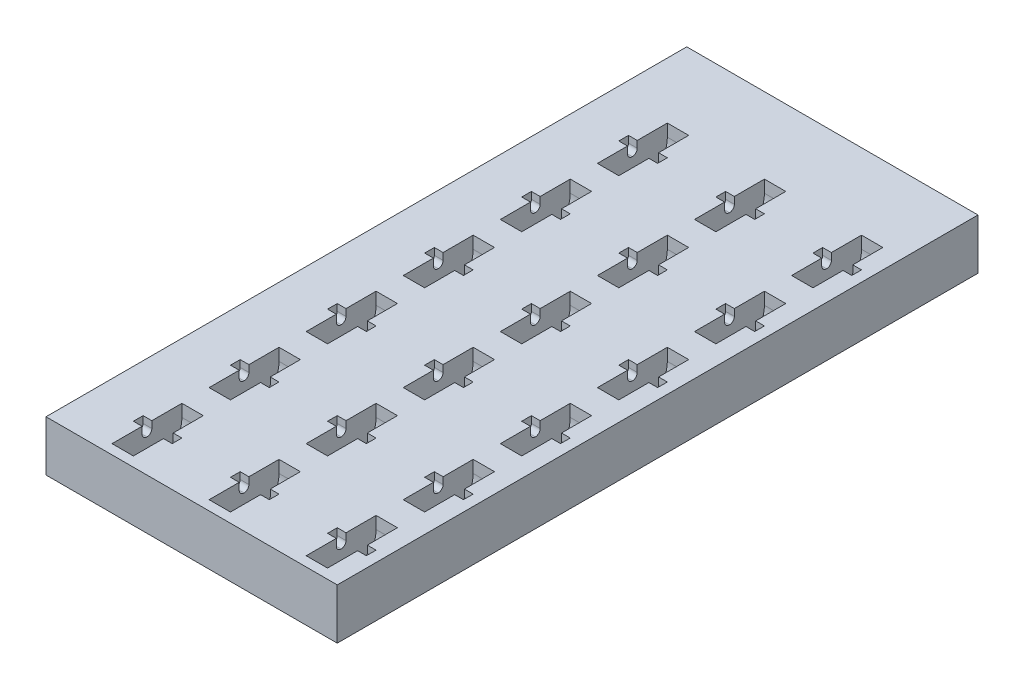
from build123d import *

# Parameters (mm, degrees)
SKETCH1_W              = 150
SKETCH1_H              = 330
BOSS_EXTRUDE1_DEPTH    = 26
SKETCH2_W              = 11
SKETCH2_H              = 36
CUT_EXTRUDE1_DEPTH     = 22
SKETCH3_W              = 20
SKETCH3_H              = 5
CUT_EXTRUDE2_DEPTH     = 6
FILLET1_R              = 15.7
FILLET2_R              = 2.5
LPATTERN1_COUNT        = 3
LPATTERN1_PITCH        = 50
LPATTERN1_COUNT_DIR2   = 6
LPATTERN1_PITCH_DIR2   = 50
FILLET1_OF_LPATTERN1_R = 15.7
FILLET2_OF_LPATTERN1_R = 2.5


with BuildPart() as part:
    # Sketch1 → Boss-Extrude1 (new body)
    with BuildSketch(Plane(origin=(0, 0, 0), x_dir=(1, 0, 0), z_dir=(0, 1, 0))):
        Rectangle(SKETCH1_W, SKETCH1_H)
    extrude(amount=BOSS_EXTRUDE1_DEPTH)

    # Sketch2 → Cut-Extrude1 (cut)
    with BuildSketch(Plane(origin=(0, 26, 0), x_dir=(1, 0, 0), z_dir=(0, 1, 0))):
        with Locations((59.5, -142)):
            Rectangle(SKETCH2_W, SKETCH2_H)
    cut_extrude1 = extrude(amount=-CUT_EXTRUDE1_DEPTH, mode=Mode.SUBTRACT)

    # Sketch3 → Cut-Extrude2 (cut)
    with BuildSketch(Plane(origin=(0, 26, 0), x_dir=(1, 0, 0), z_dir=(0, 1, 0))):
        with Locations((59.5, -142)):
            Rectangle(SKETCH3_W, SKETCH3_H)
    cut_extrude2 = extrude(amount=-CUT_EXTRUDE2_DEPTH, mode=Mode.SUBTRACT)

    # Fillet1
    fillet1_edges = [part.edges().sort_by_distance(p)[0] for p in [
        (59.5, 4, 160),
        (59.5, 4, 124),
    ]]
    fillet(fillet1_edges, radius=FILLET1_R)

    # Fillet2
    fillet2_edges = [part.edges().sort_by_distance(p)[0] for p in [
        (51.75, 20, 144.5),
        (51.75, 20, 139.5),
        (67.25, 20, 144.5),
        (67.25, 20, 139.5),
    ]]
    fillet(fillet2_edges, radius=FILLET2_R - 0.0001)  # a hair under: the kernel refuses the full size

    # LPattern1: Cut-Extrude1, Cut-Extrude2 3 × 6
    with Locations(*[(-i * LPATTERN1_PITCH, 0, -j * LPATTERN1_PITCH_DIR2) for i in range(LPATTERN1_COUNT) for j in range(LPATTERN1_COUNT_DIR2) if (i, j) != (0, 0)]):
        add(cut_extrude1, mode=Mode.SUBTRACT)
        add(cut_extrude2, mode=Mode.SUBTRACT)

    # Fillet1 of LPattern1
    fillet1_of_lpattern1_edges = [part.edges().sort_by_distance(p)[0] for p in [
        (59.5, 4, 110),
        (59.5, 4, 74),
        (59.5, 4, 60),
        (59.5, 4, 24),
        (59.5, 4, 10),
        (59.5, 4, -26),
        (59.5, 4, -40),
        (59.5, 4, -76),
        (59.5, 4, -90),
        (59.5, 4, -126),
        (9.5, 4, 160),
        (9.5, 4, 124),
        (9.5, 4, 110),
        (9.5, 4, 74),
        (9.5, 4, 60),
        (9.5, 4, 24),
        (9.5, 4, 10),
        (9.5, 4, -26),
        (9.5, 4, -40),
        (9.5, 4, -76),
        (9.5, 4, -90),
        (9.5, 4, -126),
        (-40.5, 4, 160),
        (-40.5, 4, 124),
        (-40.5, 4, 110),
        (-40.5, 4, 74),
        (-40.5, 4, 60),
        (-40.5, 4, 24),
        (-40.5, 4, 10),
        (-40.5, 4, -26),
        (-40.5, 4, -40),
        (-40.5, 4, -76),
        (-40.5, 4, -90),
        (-40.5, 4, -126),
    ]]
    fillet(fillet1_of_lpattern1_edges, radius=FILLET1_OF_LPATTERN1_R)

    # Fillet2 of LPattern1
    fillet2_of_lpattern1_edges = [part.edges().sort_by_distance(p)[0] for p in [
        (51.75, 20, 94.5),
        (51.75, 20, 89.5),
        (67.25, 20, 94.5),
        (67.25, 20, 89.5),
        (51.75, 20, 44.5),
        (51.75, 20, 39.5),
        (67.25, 20, 44.5),
        (67.25, 20, 39.5),
        (51.75, 20, -5.5),
        (51.75, 20, -10.5),
        (67.25, 20, -5.5),
        (67.25, 20, -10.5),
        (51.75, 20, -55.5),
        (51.75, 20, -60.5),
        (67.25, 20, -55.5),
        (67.25, 20, -60.5),
        (51.75, 20, -105.5),
        (51.75, 20, -110.5),
        (67.25, 20, -105.5),
        (67.25, 20, -110.5),
        (1.75, 20, 144.5),
        (1.75, 20, 139.5),
        (17.25, 20, 144.5),
        (17.25, 20, 139.5),
        (1.75, 20, 94.5),
        (1.75, 20, 89.5),
        (17.25, 20, 94.5),
        (17.25, 20, 89.5),
        (1.75, 20, 44.5),
        (1.75, 20, 39.5),
        (17.25, 20, 44.5),
        (17.25, 20, 39.5),
        (1.75, 20, -5.5),
        (1.75, 20, -10.5),
        (17.25, 20, -5.5),
        (17.25, 20, -10.5),
        (1.75, 20, -55.5),
        (1.75, 20, -60.5),
        (17.25, 20, -55.5),
        (17.25, 20, -60.5),
        (1.75, 20, -105.5),
        (1.75, 20, -110.5),
        (17.25, 20, -105.5),
        (17.25, 20, -110.5),
        (-48.25, 20, 144.5),
        (-48.25, 20, 139.5),
        (-32.75, 20, 144.5),
        (-32.75, 20, 139.5),
        (-48.25, 20, 94.5),
        (-48.25, 20, 89.5),
        (-32.75, 20, 94.5),
        (-32.75, 20, 89.5),
        (-48.25, 20, 44.5),
        (-48.25, 20, 39.5),
        (-32.75, 20, 44.5),
        (-32.75, 20, 39.5),
        (-48.25, 20, -5.5),
        (-48.25, 20, -10.5),
        (-32.75, 20, -5.5),
        (-32.75, 20, -10.5),
        (-48.25, 20, -55.5),
        (-48.25, 20, -60.5),
        (-32.75, 20, -55.5),
        (-32.75, 20, -60.5),
        (-48.25, 20, -105.5),
        (-48.25, 20, -110.5),
        (-32.75, 20, -105.5),
        (-32.75, 20, -110.5),
    ]]
    fillet(fillet2_of_lpattern1_edges, radius=FILLET2_OF_LPATTERN1_R - 0.0001)  # a hair under: the kernel refuses the full size


solid = part.part
